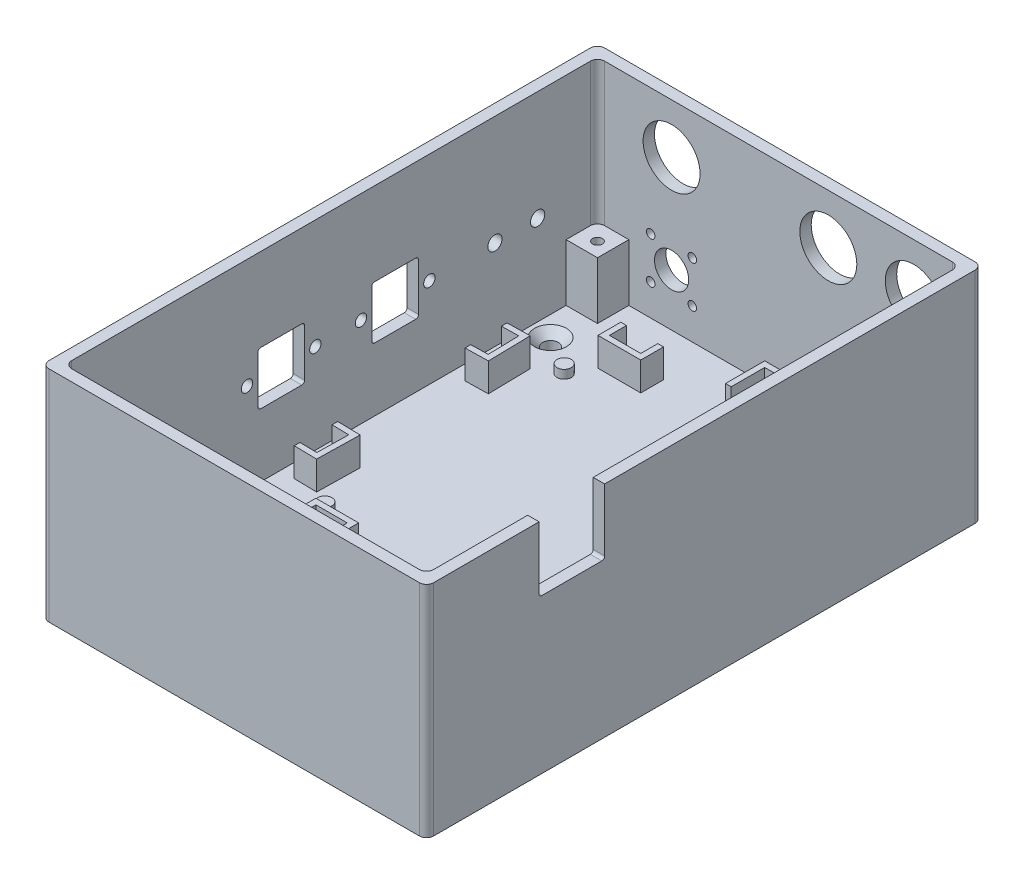
from build123d import *

# Parameters (mm, degrees)
CROQUIS1_W                                           = 135
CROQUIS1_H                                           = 195
SALIENTE_EXTRUIR1_DEPTH                              = 7
CROQUIS2_W                                           = 135
CROQUIS2_H                                           = 195
CROQUIS2_W_2                                         = 127
CROQUIS2_H_2                                         = 187
SALIENTE_EXTRUIR2_DEPTH                              = 70
CROQUIS4_W                                           = 23
CROQUIS4_H                                           = 22.9
CORTAR_EXTRUIR1_DEPTH                                = 4
CROQUIS8_R                                           = 2.5
SALIENTE_EXTRUIR3_DEPTH                              = 3
CROQUIS11_W                                          = 14
CROQUIS11_H                                          = 9
CROQUIS11_W_2                                        = 8.5
CROQUIS11_H_2                                        = 14
SALIENTE_EXTRUIR5_DEPTH                              = 3
CORTAR_EXTRUIR2_START                                = -10
CORTAR_EXTRUIR2_DEPTH                                = 10
REFRENTADO_PARA_TORNILLO_TAP_N_CON_CABEZ_D           = 5.5
REFRENTADO_PARA_TORNILLO_TAP_N_CON_CABEZ_DEPTH       = 8.2
REFRENTADO_PARA_TORNILLO_TAP_N_CON_CABEZ_CSINK_D     = 11.2
REFRENTADO_PARA_TORNILLO_TAP_N_CON_CABEZ_CSINK_ANGLE = 90
REFRENTADO_PARA_TORNILLO_TAP_N_CON_CABEZ_TIP         = 1.652366702
CROQUIS24_R                                          = 5.5
CORTAR_EXTRUIR3_DEPTH                                = 4
CROQUIS25_R                                          = 2
CROQUIS25_W                                          = 16.4
CROQUIS25_H                                          = 18.6
CORTAR_EXTRUIR4_DEPTH                                = 4
CROQUIS26_R                                          = 2.5
CORTAR_EXTRUIR5_DEPTH                                = 4
MATRIZL1_START                                       = -15
MATRIZL1_OUTLINE_W                                   = 18.6
MATRIZL1_OUTLINE_H                                   = 16.4
MATRIZL1_OUTLINE_R                                   = 2
MATRIZL1_DEPTH                                       = 4
CROQUIS27_R                                          = 10
CORTAR_EXTRUIR6_DEPTH                                = 10
REDONDEO1_R                                          = 2.5
CROQUIS28_R                                          = 1.5
CROQUIS28_R_2                                        = 6
CORTAR_EXTRUIR7_DEPTH                                = 10
SALIENTE_EXTRUIR6_DEPTH                              = 7
MATRIZL2_START                                       = -93.5
MATRIZL2_OUTLINE_W                                   = 2
MATRIZL2_OUTLINE_H                                   = 7
MATRIZL2_OUTLINE_W_2                                 = 3
MATRIZL2_OUTLINE_W_3                                 = 1
MATRIZL2_DEPTH                                       = 13.75
MATRIZL2_2_OUTLINE_W                                 = 16
MATRIZL2_2_OUTLINE_H                                 = 7
MATRIZL2_2_DEPTH                                     = 2
SALIENTE_EXTRUIR7_START                              = 20
SALIENTE_EXTRUIR7_DEPTH                              = 20
REFRENTADO_PARA_TORNILLO_CON_CABEZA_TRON_D           = 3.4
REFRENTADO_PARA_TORNILLO_CON_CABEZA_TRON_CBORE_D     = 7
REFRENTADO_PARA_TORNILLO_CON_CABEZA_TRON_CBORE_DEPTH = 24.6
REFRENTADO_PARA_TORNILLO_TAP_N_CON_C_2_D             = 3.4
REFRENTADO_PARA_TORNILLO_TAP_N_CON_C_2_CSINK_D       = 6.72
REFRENTADO_PARA_TORNILLO_TAP_N_CON_C_2_CSINK_ANGLE   = 90
EXTRUIR_L_MINA1_DEPTH                                = 10
SIMETR_A2_COPY_1_DEPTH                               = 10
EXTRUIR_L_MINA2_DEPTH                                = 10
REDONDEO2_R                                          = 1


# Read off the part's stored shape, not the designer's step: MatrizL1, MatrizL2
with BuildPart() as part:
    # Croquis1 → Saliente-Extruir1 (new body)
    with BuildSketch(Plane(origin=(0, 4, 0), x_dir=(1, 0, 0), z_dir=(0, 1, 0))):
        with Locations((52.5, 0)):
            Rectangle(CROQUIS1_W, CROQUIS1_H)
    extrude(amount=SALIENTE_EXTRUIR1_DEPTH)

    # Croquis2 → Saliente-Extruir2 (add)
    with BuildSketch(Plane(origin=(0, 11, 0), x_dir=(1, 0, 0), z_dir=(0, 1, 0))):
        with Locations((52.5, 0)):
            Rectangle(CROQUIS2_W, CROQUIS2_H)
        with Locations((52.5, 0)):
            Rectangle(CROQUIS2_W_2, CROQUIS2_H_2, mode=Mode.SUBTRACT)
    extrude(amount=SALIENTE_EXTRUIR2_DEPTH)

    # Croquis4 → Cortar-Extruir1 (cut)
    with BuildSketch(Plane(origin=(120, 0, 0), x_dir=(0, 0, -1), z_dir=(1, 0, 0))):
        with Locations((-46.5, 69.55)):
            Rectangle(CROQUIS4_W, CROQUIS4_H)
    extrude(amount=-CORTAR_EXTRUIR1_DEPTH, mode=Mode.SUBTRACT)

    # Croquis8 → Saliente-Extruir3 (add)
    with BuildSketch(Plane(origin=(0, 11, 0), x_dir=(1, 0, 0), z_dir=(0, 1, 0))):
        with Locations(Location((9.319637685, 61.500714176, 0), (0, 0, 270))):
            Circle(CROQUIS8_R)
        with Locations(Location((95.035380903, 61.500714176, 0), (0, 0, 90))):
            Circle(CROQUIS8_R)
        with Locations(Location((95.035380903, -22.500714176, 0), (0, 0, 270))):
            Circle(CROQUIS8_R)
        with Locations(Location((9.319637685, -22.500714176, 0), (0, 0, 90))):
            Circle(CROQUIS8_R)
    extrude(amount=SALIENTE_EXTRUIR3_DEPTH)

    # Croquis11 → Saliente-Extruir5 (add)
    with BuildSketch(Plane(origin=(0, 11, 0), x_dir=(1, 0, 0), z_dir=(0, 1, 0))):
        Polygon((-3, -43.16), (-11, -43.16), (-11, -38.16), (-11, -36.16), (-3, -36.16), align=None)
        with Locations((4, -89)):
            Rectangle(CROQUIS11_W, CROQUIS11_H)
        with Locations((54.83, -56.16)):
            Rectangle(CROQUIS11_W_2, CROQUIS11_H_2)
    extrude(amount=SALIENTE_EXTRUIR5_DEPTH)

    # Croquis10 → Cortar-Extruir2 (cut)
    with BuildSketch(Plane(origin=(0, 14, 0), x_dir=(1, 0, 0), z_dir=(0, 1, 0)).offset(CORTAR_EXTRUIR2_START)):
        with BuildLine():
            ThreePointArc((53.440054, -55.94), (55.04, -57.539946), (56.639946, -55.94))
            ThreePointArc((56.639946, -55.94), (55.04, -54.340054), (53.440054, -55.94))
        make_face()
        with BuildLine():
            ThreePointArc((1.370054, -88.96), (2.97, -90.559946), (4.569946, -88.96))
            ThreePointArc((4.569946, -88.96), (2.97, -87.360054), (1.370054, -88.96))
        make_face()
    extrude(amount=CORTAR_EXTRUIR2_DEPTH, mode=Mode.SUBTRACT)

    # Refrentado para tornillo tap_n con cabez
    with Locations(Plane(origin=(0, 11, 0), x_dir=(1, 0, 0), z_dir=(0, 1, 0))):
        with Locations((-4, 70), (-4, -70)):
            CounterSinkHole(REFRENTADO_PARA_TORNILLO_TAP_N_CON_CABEZ_D / 2, REFRENTADO_PARA_TORNILLO_TAP_N_CON_CABEZ_CSINK_D / 2, depth=REFRENTADO_PARA_TORNILLO_TAP_N_CON_CABEZ_DEPTH, counter_sink_angle=REFRENTADO_PARA_TORNILLO_TAP_N_CON_CABEZ_CSINK_ANGLE)
            with Locations((0, 0, -(REFRENTADO_PARA_TORNILLO_TAP_N_CON_CABEZ_DEPTH + REFRENTADO_PARA_TORNILLO_TAP_N_CON_CABEZ_TIP / 2))):  # 118° drill point
                Cone(0, REFRENTADO_PARA_TORNILLO_TAP_N_CON_CABEZ_D / 2, REFRENTADO_PARA_TORNILLO_TAP_N_CON_CABEZ_TIP, mode=Mode.SUBTRACT)

    # Croquis24 → Cortar-Extruir3 (cut)
    with BuildSketch(Plane.ZY.offset(15)):
        with Locations((51.93696, 21.975)):
            Circle(CROQUIS24_R)
        with BuildLine():
            Line((89.360054, 13.905), (89.360054, 19.845))
            ThreePointArc((89.360054, 19.845), (89.213607391, 20.198553391), (88.860054, 20.345))
            Line((88.860054, 20.345), (75.774838363, 20.345))
            ThreePointArc((75.774838363, 20.345), (75.421284972, 20.198553391), (75.274838363, 19.845))
            Line((75.274838363, 19.845), (75.274838363, 13.905))
            ThreePointArc((75.274838363, 13.905), (75.421284972, 13.551446609), (75.774838363, 13.405))
            Line((75.774838363, 13.405), (88.860054, 13.405))
            ThreePointArc((88.860054, 13.405), (89.213607391, 13.551446609), (89.360054, 13.905))
        make_face()
    extrude(amount=-CORTAR_EXTRUIR3_DEPTH, mode=Mode.SUBTRACT)

    # Croquis25 → Cortar-Extruir4 (cut)
    with BuildSketch(Plane.ZY.offset(15)):
        with Locations((29.5, 42.5)):
            Circle(CROQUIS25_R)
        with Locations((5.5, 42.5)):
            Circle(CROQUIS25_R)
        with Locations((17.5, 42.5)):
            Rectangle(CROQUIS25_W, CROQUIS25_H)
    extrude(amount=-CORTAR_EXTRUIR4_DEPTH, mode=Mode.SUBTRACT)

    # Croquis26 → Cortar-Extruir5 (cut)
    with BuildSketch(Plane.ZY.offset(15)):
        with Locations((-72.5, 42.5)):
            Circle(CROQUIS26_R)
        with Locations((-57.5, 42.5)):
            Circle(CROQUIS26_R)
    extrude(amount=-CORTAR_EXTRUIR5_DEPTH, mode=Mode.SUBTRACT)

    # MatrizL1 outline → MatrizL1 (cut)
    with BuildSketch(Plane.YZ.offset(MATRIZL1_START)):
        with Locations((42.5, -22.5)):
            Rectangle(MATRIZL1_OUTLINE_W, MATRIZL1_OUTLINE_H)
        with Locations((42.5, -10.5)):
            Circle(MATRIZL1_OUTLINE_R)
        with Locations((42.5, -34.5)):
            Circle(MATRIZL1_OUTLINE_R)
    extrude(amount=MATRIZL1_DEPTH, mode=Mode.SUBTRACT)

    # Croquis27 → Cortar-Extruir6 (cut)
    with BuildSketch(Plane(origin=(0, 0, -97.5), x_dir=(-1, 0, 0), z_dir=(0, 0, -1))):
        with Locations((-100, 63.5)):
            Circle(CROQUIS27_R)
        with Locations((-70, 63.5)):
            Circle(CROQUIS27_R)
        with Locations((-15, 63.5)):
            Circle(CROQUIS27_R)
    extrude(amount=-CORTAR_EXTRUIR6_DEPTH, mode=Mode.SUBTRACT)

    # Redondeo1
    redondeo1_edges = [part.edges().sort_by_distance(p)[0] for p in [
        (-11, 46, 93.5),
        (116, 46, 93.5),
        (116, 46, -93.5),
        (-11, 46, -93.5),
        (-15, 42.5, 97.5),
        (-15, 42.5, -97.5),
        (120, 42.5, -97.5),
        (120, 42.5, 97.5),
    ]]
    fillet(redondeo1_edges, radius=REDONDEO1_R)

    # Croquis28 → Cortar-Extruir7 (cut)
    with BuildSketch(Plane(origin=(0, 0, -97.5), x_dir=(-1, 0, 0), z_dir=(0, 0, -1))):
        with Locations((-7.675, 36.6)):
            Circle(CROQUIS28_R)
        with Locations((-22.275, 36.6)):
            Circle(CROQUIS28_R)
        with Locations((-22.275, 22)):
            Circle(CROQUIS28_R)
        with Locations((-7.675, 22)):
            Circle(CROQUIS28_R)
        with Locations((-15, 29.275)):
            Circle(CROQUIS28_R_2)
    extrude(amount=-CORTAR_EXTRUIR7_DEPTH, mode=Mode.SUBTRACT)

    # Croquis33 → Saliente-Extruir6 (add)
    with BuildSketch(Plane(origin=(0, 11, 0), x_dir=(1, 0, 0), z_dir=(0, 1, 0))):
        Polygon((87.677509294, 79.75), (87.677509294, 91.5), (103.677509294, 91.5), (103.677509294, 79.75), (105.677509294, 79.75), (105.677509294, 93.5), (85.677509294, 93.5), (85.677509294, 79.75), align=None)
    extrude(amount=SALIENTE_EXTRUIR6_DEPTH)

    # MatrizL2 outline → MatrizL2 (add)
    with BuildSketch(Plane.XY.offset(MATRIZL2_START)):
        with Locations((48.677509294, 14.5)):
            Rectangle(MATRIZL2_OUTLINE_W, MATRIZL2_OUTLINE_H)
        with Locations((67.177509294, 14.5)):
            Rectangle(MATRIZL2_OUTLINE_W_2, MATRIZL2_OUTLINE_H)
        with Locations((85.177509294, 14.5)):
            Rectangle(MATRIZL2_OUTLINE_W_3, MATRIZL2_OUTLINE_H)
    extrude(amount=MATRIZL2_DEPTH)

    # MatrizL2 2 outline → MatrizL2 2 (add)
    with BuildSketch(Plane.XY.offset(MATRIZL2_START)):
        with Locations((57.677509294, 14.5)):
            Rectangle(MATRIZL2_2_OUTLINE_W, MATRIZL2_2_OUTLINE_H)
        with Locations((76.677509294, 14.5)):
            Rectangle(MATRIZL2_2_OUTLINE_W, MATRIZL2_2_OUTLINE_H)
    extrude(amount=MATRIZL2_2_DEPTH)

    # Croquis34 → Saliente-Extruir7 (add)
    with BuildSketch(Plane(origin=(0, 11, 0), x_dir=(1, 0, 0), z_dir=(0, 1, 0)).offset(SALIENTE_EXTRUIR7_START)):
        with BuildLine():
            Line((-8.5, 93.5), (0, 93.5))
            Line((0, 93.5), (0, 82.5))
            Line((0, 82.5), (-11, 82.5))
            Line((-11, 82.5), (-11, 91))
            ThreePointArc((-11, 91), (-10.267766953, 92.767766953), (-8.5, 93.5))
        make_face()
        with BuildLine():
            Line((113.5, -93.5), (105, -93.5))
            Line((105, -93.5), (105, -82.5))
            Line((105, -82.5), (116, -82.5))
            Line((116, -82.5), (116, -91))
            ThreePointArc((116, -91), (115.267766953, -92.767766953), (113.5, -93.5))
        make_face()
    extrude(amount=-SALIENTE_EXTRUIR7_DEPTH)

    # Refrentado para tornillo con cabeza troncocónica de M31 (through all)
    with Locations(Plane(origin=(0, 4, 0), x_dir=(-1, 0, 0), z_dir=(0, -1, 0))):
        with Locations((5, 87.5), (-110, -87.5)):
            CounterBoreHole(REFRENTADO_PARA_TORNILLO_CON_CABEZA_TRON_D / 2, REFRENTADO_PARA_TORNILLO_CON_CABEZA_TRON_CBORE_D / 2, REFRENTADO_PARA_TORNILLO_CON_CABEZA_TRON_CBORE_DEPTH)

    # Refrentado para tornillo tap_n con c 2 (through all)
    with Locations(Plane(origin=(0, 11, 0), x_dir=(1, 0, 0), z_dir=(0, 1, 0))):
        with Locations((112, 20.15), (112, -20.15)):
            CounterSinkHole(REFRENTADO_PARA_TORNILLO_TAP_N_CON_C_2_D / 2, REFRENTADO_PARA_TORNILLO_TAP_N_CON_C_2_CSINK_D / 2, counter_sink_angle=REFRENTADO_PARA_TORNILLO_TAP_N_CON_C_2_CSINK_ANGLE)

    # Croquis39 → Extruir-Lámina1 (add)
    with BuildSketch(Plane(origin=(0, 11, 0), x_dir=(1, 0, 0), z_dir=(0, 1, 0))):
        Polygon((13.677509294, 77), (13.677509294, 69), (28.677509294, 69), (28.677509294, 77), (26.677509294, 77), (26.677509294, 71), (15.677509294, 71), (15.677509294, 77), align=None)
    extruir_l_mina1 = extrude(amount=EXTRUIR_L_MINA1_DEPTH)

    # Simetría1: Extruir-Lámina1 across plane
    add(extruir_l_mina1.mirror(Plane(origin=(35.309773478, 0, -36.0303811), x_dir=(0.7142128391425073, 0, 0.6999285823596568), z_dir=(-0.6999285823596568, 0, 0.7142128391425073))))

    # Simetría2: Extruir-Lámina1 across plane
    add(extruir_l_mina1.mirror(Plane.XY.offset(-19.5)))

    # Simetría2 copy 1 sketch → Simetría2 copy 1 (add)
    with BuildSketch(Plane(origin=(70.619546956, 11, 33.0607622), x_dir=(0.020199959192002237, 0, -0.9997959600081615), z_dir=(0, 1, 0))):
        Polygon((13.677509294, 77), (13.677509294, 69), (28.677509294, 69), (28.677509294, 77), (26.677509294, 77), (26.677509294, 71), (15.677509294, 71), (15.677509294, 77), align=None)
    extrude(amount=SIMETR_A2_COPY_1_DEPTH)

    # Croquis40 → Extruir-Lámina2 (add)
    with BuildSketch(Plane(origin=(0, 11, 0), x_dir=(1, 0, 0), z_dir=(0, 1, 0))):
        Polygon((77.177509294, -38), (77.177509294, -30), (92.177509294, -30), (92.177509294, -38), (90.177509294, -38), (90.177509294, -32), (79.177509294, -32), (79.177509294, -38), align=None)
        Polygon((110.677509294, -7.5), (102.677509294, -7.5), (102.677509294, 7.5), (110.677509294, 7.5), (110.677509294, 5.5), (104.677509294, 5.5), (104.677509294, -5.5), (110.677509294, -5.5), align=None)
    extrude(amount=EXTRUIR_L_MINA2_DEPTH)

    # Redondeo2
    redondeo2_edges = [part.edges().sort_by_distance(p)[0] for p in [
        (-13, 51.8, 25.7),
        (-13, 33.2, 25.7),
        (-13, 33.2, 9.3),
        (-13, 51.8, 9.3),
        (-13, 51.8, -14.3),
        (-13, 33.2, -14.3),
        (-13, 33.2, -30.7),
        (-13, 51.8, -30.7),
        (118, 58.1, 58),
        (118, 58.1, 35),
    ]]
    fillet(redondeo2_edges, radius=REDONDEO2_R)


solid = part.part
